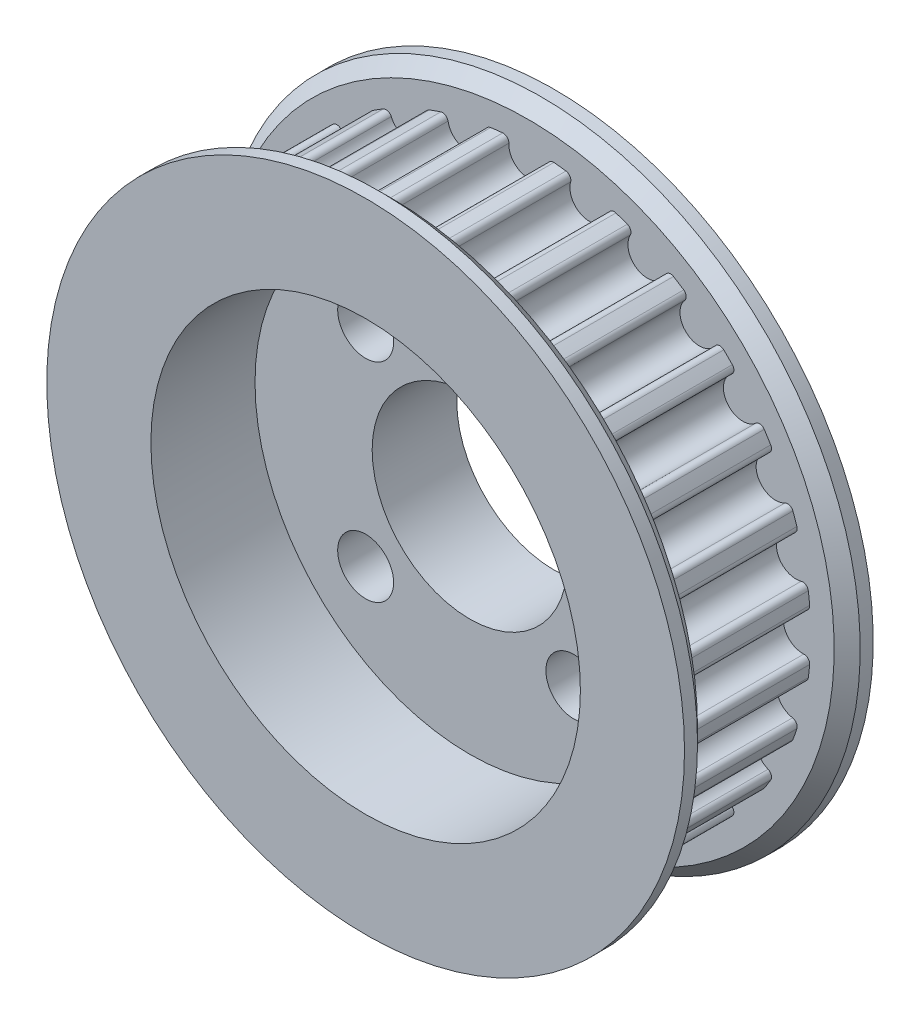
from build123d import *
from build123d.topology import SkipClean

# Parameters (mm, degrees)
CUT_EXTRUDE1_START     = 1.3716
CUT_EXTRUDE1_DEPTH     = 10.668
SKETCH5_R              = 2.0828
CUT_EXTRUDE2_DEPTH     = 36.371618123
CIRPATTERN1_COUNT      = 2
CIRPATTERN1_ANGLE      = 90
INTERSECT1_START       = 1.3716
INTERSECT1_OUTLINE_R   = 23.8125
INTERSECT1_OUTLINE_R_2 = 3.175
INTERSECT1_DEPTH       = 9.4488
INTERSECT2_START       = -10.8204
INTERSECT2_OUTLINE_R   = 23.8125
INTERSECT2_OUTLINE_R_2 = 3.175
INTERSECT2_DEPTH       = 1.691999918
SKETCH9_R              = 16.5
SKETCH9_R_2            = 4.1
CUT_EXTRUDE3_DEPTH     = 6
SKETCH11_R             = 7.5
CUT_EXTRUDE4_DEPTH     = 7
BOSS_EXTRUDE2_REACH    = 38.834
SKETCH12_R             = 16.5
SKETCH12_R_2           = 7.5
SKETCH12_3_R           = 24.5
SKETCH12_3_R_2         = 7.5
BOSS_EXTRUDE3_DEPTH    = 1
M4_CLEARANCE_HOLE1_D   = 4.3
BOSS_EXTRUDE4_START    = 1
SKETCH16_R             = 24.5
SKETCH16_R_2           = 16.5
BOSS_EXTRUDE4_DEPTH    = 1


# Read off the part's stored shape, not the designer's step: Intersect1, Intersect2
with BuildPart() as part:
    # Sketch3 → Revolve1 (revolve)
    with BuildSketch(Plane(origin=(0, 0, 0), x_dir=(0, 0, -1), z_dir=(1, 0, 0)), mode=Mode.PRIVATE) as revolve1_sk:
        Polygon((10.8204, 3.651), (10.8204, 17.1069), (10.3124, 17.1069), (10.3124, 22.225), (10.8204, 23.8125), (9.8044, 23.8125), (9.2964, 22.225), (9.2964, 21.7043), (-1.3716, 21.7043), (-1.3716, 22.225), (-1.8796, 23.8125), (-2.8956, 23.8125), (-2.3876, 22.225), (-2.3876, 17.1069), (-2.8956, 17.1069), (-2.8956, 15.0749), (-10.8204, 15.0749), (-10.8204, 3.651), (-10.3444, 3.175), (10.3444, 3.175), align=None)
    revolve(revolve1_sk.sketch.rotate(Axis((0, 0, 10.8204), (0, 0, -1)), 180), axis=Axis((0, 0, 10.8204), (0, 0, -1)))

    # Sketch4 → Cut-Extrude1 (cut)
    with SkipClean():  # the faces are left unmerged after this step: merging them gives an invalid solid
        with BuildSketch(Plane.XY.offset(CUT_EXTRUDE1_START)):
            with BuildLine():
                Line((-2.188041211, 21.593728584), (-2.412864046, 23.8125))
                Line((-2.412864046, 23.8125), (2.412864046, 23.8125))
                Line((2.412864046, 23.8125), (2.188041211, 21.593728584))
                ThreePointArc((2.188041211, 21.593728584), (2.077661488, 21.604628236), (1.967227505, 21.614963669))
                ThreePointArc((1.967227505, 21.614963669), (1.629214917, 21.49658956), (1.496806829, 21.16382382))
                ThreePointArc((1.496806829, 21.16382382), (0, 19.591934831), (-1.496806829, 21.16382382))
                ThreePointArc((-1.496806829, 21.16382382), (-1.629214917, 21.49658956), (-1.967227505, 21.614963669))
                ThreePointArc((-1.967227505, 21.614963669), (-2.077661488, 21.604628236), (-2.188041211, 21.593728584))
            make_face()
            with BuildLine():
                Line((2.671874203, 21.539213698), (2.946411233, 23.75238367))
                Line((2.946411233, 23.75238367), (7.651148247, 22.678558148))
                Line((7.651148247, 22.678558148), (6.938239101, 20.565443751))
                ThreePointArc((6.938239101, 20.565443751), (6.833052229, 20.600631925), (6.727686908, 20.6352821))
                ThreePointArc((6.727686908, 20.6352821), (6.371808284, 20.595090754), (6.1686726, 20.300131717))
                ThreePointArc((6.1686726, 20.300131717), (4.359615637, 19.100724121), (3.250115086, 20.966273425))
                ThreePointArc((3.250115086, 20.966273425), (3.195074088, 21.320159604), (2.891876899, 21.510780704))
                ThreePointArc((2.891876899, 21.510780704), (2.781911877, 21.525278275), (2.671874203, 21.539213698))
            make_face()
            with BuildLine():
                Line((7.397810687, 20.404632698), (8.15794115, 22.501223641))
                Line((8.15794115, 22.501223641), (12.505771926, 20.407418693))
                Line((12.505771926, 20.407418693), (11.340524712, 18.505921694))
                ThreePointArc((11.340524712, 18.505921694), (11.2458052, 18.563633909), (11.150791996, 18.620861321))
                ThreePointArc((11.150791996, 18.620861321), (10.794892576, 18.6608681), (10.531215368, 18.418506244))
                ThreePointArc((10.531215368, 18.418506244), (8.500621941, 17.651723345), (7.834062659, 19.717386532))
                ThreePointArc((7.834062659, 19.717386532), (7.859148737, 20.07464782), (7.605970519, 20.327957373))
                ThreePointArc((7.605970519, 20.327957373), (7.501988563, 20.366560978), (7.397810687, 20.404632698))
            make_face()
            with BuildLine():
                Line((11.752790053, 18.246878212), (12.960397832, 20.121758302))
                Line((12.960397832, 20.121758302), (16.733303981, 17.11296605))
                Line((16.733303981, 17.11296605), (15.174149059, 15.51843545))
                ThreePointArc((15.174149059, 15.51843545), (15.094646539, 15.595777773), (15.014749812, 15.672712802))
                ThreePointArc((15.014749812, 15.672712802), (14.67667588, 15.790911598), (14.365679023, 15.613299959))
                ThreePointArc((14.365679023, 15.613299959), (12.215371566, 15.317591454), (12.025177618, 17.479787546))
                ThreePointArc((12.025177618, 17.479787546), (12.129132852, 17.82250937), (11.938669019, 18.125805377))
                ThreePointArc((11.938669019, 18.125805377), (11.845884217, 18.186579272), (11.752790053, 18.246878212))
            make_face()
            with BuildLine():
                Line((15.51843545, 15.174149059), (17.11296605, 16.733303981))
                Line((17.11296605, 16.733303981), (20.121758302, 12.960397832))
                Line((20.121758302, 12.960397832), (18.246878212, 11.752790053))
                ThreePointArc((18.246878212, 11.752790053), (18.186579272, 11.845884217), (18.125805377, 11.938669019))
                ThreePointArc((18.125805377, 11.938669019), (17.82250937, 12.129132852), (17.479787546, 12.025177618))
                ThreePointArc((17.479787546, 12.025177618), (15.317591454, 12.215371566), (15.613299959, 14.365679023))
                ThreePointArc((15.613299959, 14.365679023), (15.790911598, 14.67667588), (15.672712802, 15.014749812))
                ThreePointArc((15.672712802, 15.014749812), (15.595777773, 15.094646539), (15.51843545, 15.174149059))
            make_face()
            with BuildLine():
                Line((18.505921694, 11.340524712), (20.407418693, 12.505771926))
                Line((20.407418693, 12.505771926), (22.501223641, 8.15794115))
                Line((22.501223641, 8.15794115), (20.404632698, 7.397810687))
                ThreePointArc((20.404632698, 7.397810687), (20.366560978, 7.501988563), (20.327957373, 7.605970519))
                ThreePointArc((20.327957373, 7.605970519), (20.07464782, 7.859148737), (19.717386532, 7.834062659))
                ThreePointArc((19.717386532, 7.834062659), (17.651723345, 8.500621941), (18.418506244, 10.531215368))
                ThreePointArc((18.418506244, 10.531215368), (18.6608681, 10.794892576), (18.620861321, 11.150791996))
                ThreePointArc((18.620861321, 11.150791996), (18.563633909, 11.2458052), (18.505921694, 11.340524712))
            make_face()
            with BuildLine():
                Line((20.565443751, 6.938239101), (22.678558148, 7.651148247))
                Line((22.678558148, 7.651148247), (23.75238367, 2.946411233))
                Line((23.75238367, 2.946411233), (21.539213698, 2.671874203))
                ThreePointArc((21.539213698, 2.671874203), (21.525278275, 2.781911877), (21.510780704, 2.891876899))
                ThreePointArc((21.510780704, 2.891876899), (21.320159604, 3.195074088), (20.966273425, 3.250115086))
                ThreePointArc((20.966273425, 3.250115086), (19.100724121, 4.359615637), (20.300131717, 6.1686726))
                ThreePointArc((20.300131717, 6.1686726), (20.595090754, 6.371808284), (20.6352821, 6.727686908))
                ThreePointArc((20.6352821, 6.727686908), (20.600631925, 6.833052229), (20.565443751, 6.938239101))
            make_face()
            with BuildLine():
                Line((21.593728584, 2.188041211), (23.8125, 2.412864046))
                Line((23.8125, 2.412864046), (23.8125, -2.412864046))
                Line((23.8125, -2.412864046), (21.593728584, -2.188041211))
                ThreePointArc((21.593728584, -2.188041211), (21.604628236, -2.077661488), (21.614963669, -1.967227505))
                ThreePointArc((21.614963669, -1.967227505), (21.49658956, -1.629214917), (21.16382382, -1.496806829))
                ThreePointArc((21.16382382, -1.496806829), (19.591934831, 0), (21.16382382, 1.496806829))
                ThreePointArc((21.16382382, 1.496806829), (21.49658956, 1.629214917), (21.614963669, 1.967227505))
                ThreePointArc((21.614963669, 1.967227505), (21.604628236, 2.077661488), (21.593728584, 2.188041211))
            make_face()
            with BuildLine():
                Line((21.539213698, -2.671874203), (23.75238367, -2.946411233))
                Line((23.75238367, -2.946411233), (22.678558148, -7.651148247))
                Line((22.678558148, -7.651148247), (20.565443751, -6.938239101))
                ThreePointArc((20.565443751, -6.938239101), (20.600631925, -6.833052229), (20.6352821, -6.727686908))
                ThreePointArc((20.6352821, -6.727686908), (20.595090754, -6.371808284), (20.300131717, -6.1686726))
                ThreePointArc((20.300131717, -6.1686726), (19.100724121, -4.359615637), (20.966273425, -3.250115086))
                ThreePointArc((20.966273425, -3.250115086), (21.320159604, -3.195074088), (21.510780704, -2.891876899))
                ThreePointArc((21.510780704, -2.891876899), (21.525278275, -2.781911877), (21.539213698, -2.671874203))
            make_face()
            with BuildLine():
                Line((20.404632698, -7.397810687), (22.501223641, -8.15794115))
                Line((22.501223641, -8.15794115), (20.407418693, -12.505771926))
                Line((20.407418693, -12.505771926), (18.505921694, -11.340524712))
                ThreePointArc((18.505921694, -11.340524712), (18.563633909, -11.2458052), (18.620861321, -11.150791996))
                ThreePointArc((18.620861321, -11.150791996), (18.6608681, -10.794892576), (18.418506244, -10.531215368))
                ThreePointArc((18.418506244, -10.531215368), (17.651723345, -8.500621941), (19.717386532, -7.834062659))
                ThreePointArc((19.717386532, -7.834062659), (20.07464782, -7.859148737), (20.327957373, -7.605970519))
                ThreePointArc((20.327957373, -7.605970519), (20.366560978, -7.501988563), (20.404632698, -7.397810687))
            make_face()
            with BuildLine():
                Line((18.246878212, -11.752790053), (20.121758302, -12.960397832))
                Line((20.121758302, -12.960397832), (17.11296605, -16.733303981))
                Line((17.11296605, -16.733303981), (15.51843545, -15.174149059))
                ThreePointArc((15.51843545, -15.174149059), (15.595777773, -15.094646539), (15.672712802, -15.014749812))
                ThreePointArc((15.672712802, -15.014749812), (15.790911598, -14.67667588), (15.613299959, -14.365679023))
                ThreePointArc((15.613299959, -14.365679023), (15.317591454, -12.215371566), (17.479787546, -12.025177618))
                ThreePointArc((17.479787546, -12.025177618), (17.82250937, -12.129132852), (18.125805377, -11.938669019))
                ThreePointArc((18.125805377, -11.938669019), (18.186579272, -11.845884217), (18.246878212, -11.752790053))
            make_face()
            with BuildLine():
                Line((15.174149059, -15.51843545), (16.733303981, -17.11296605))
                Line((16.733303981, -17.11296605), (12.960397832, -20.121758302))
                Line((12.960397832, -20.121758302), (11.752790053, -18.246878212))
                ThreePointArc((11.752790053, -18.246878212), (11.845884217, -18.186579272), (11.938669019, -18.125805377))
                ThreePointArc((11.938669019, -18.125805377), (12.129132852, -17.82250937), (12.025177618, -17.479787546))
                ThreePointArc((12.025177618, -17.479787546), (12.215371566, -15.317591454), (14.365679023, -15.613299959))
                ThreePointArc((14.365679023, -15.613299959), (14.67667588, -15.790911598), (15.014749812, -15.672712802))
                ThreePointArc((15.014749812, -15.672712802), (15.094646539, -15.595777773), (15.174149059, -15.51843545))
            make_face()
            with BuildLine():
                Line((11.340524712, -18.505921694), (12.505771926, -20.407418693))
                Line((12.505771926, -20.407418693), (8.15794115, -22.501223641))
                Line((8.15794115, -22.501223641), (7.397810687, -20.404632698))
                ThreePointArc((7.397810687, -20.404632698), (7.501988563, -20.366560978), (7.605970519, -20.327957373))
                ThreePointArc((7.605970519, -20.327957373), (7.859148737, -20.07464782), (7.834062659, -19.717386532))
                ThreePointArc((7.834062659, -19.717386532), (8.500621941, -17.651723345), (10.531215368, -18.418506244))
                ThreePointArc((10.531215368, -18.418506244), (10.794892576, -18.6608681), (11.150791996, -18.620861321))
                ThreePointArc((11.150791996, -18.620861321), (11.2458052, -18.563633909), (11.340524712, -18.505921694))
            make_face()
            with BuildLine():
                Line((6.938239101, -20.565443751), (7.651148247, -22.678558148))
                Line((7.651148247, -22.678558148), (2.946411233, -23.75238367))
                Line((2.946411233, -23.75238367), (2.671874203, -21.539213698))
                ThreePointArc((2.671874203, -21.539213698), (2.781911877, -21.525278275), (2.891876899, -21.510780704))
                ThreePointArc((2.891876899, -21.510780704), (3.195074088, -21.320159604), (3.250115086, -20.966273425))
                ThreePointArc((3.250115086, -20.966273425), (4.359615637, -19.100724121), (6.1686726, -20.300131717))
                ThreePointArc((6.1686726, -20.300131717), (6.371808284, -20.595090754), (6.727686908, -20.6352821))
                ThreePointArc((6.727686908, -20.6352821), (6.833052229, -20.600631925), (6.938239101, -20.565443751))
            make_face()
            with BuildLine():
                Line((2.188041211, -21.593728584), (2.412864046, -23.8125))
                Line((2.412864046, -23.8125), (-2.412864046, -23.8125))
                Line((-2.412864046, -23.8125), (-2.188041211, -21.593728584))
                ThreePointArc((-2.188041211, -21.593728584), (-2.077661488, -21.604628236), (-1.967227505, -21.614963669))
                ThreePointArc((-1.967227505, -21.614963669), (-1.629214917, -21.49658956), (-1.496806829, -21.16382382))
                ThreePointArc((-1.496806829, -21.16382382), (0, -19.591934831), (1.496806829, -21.16382382))
                ThreePointArc((1.496806829, -21.16382382), (1.629214917, -21.49658956), (1.967227505, -21.614963669))
                ThreePointArc((1.967227505, -21.614963669), (2.077661488, -21.604628236), (2.188041211, -21.593728584))
            make_face()
            with BuildLine():
                Line((-2.671874203, -21.539213698), (-2.946411233, -23.75238367))
                Line((-2.946411233, -23.75238367), (-7.651148247, -22.678558148))
                Line((-7.651148247, -22.678558148), (-6.938239101, -20.565443751))
                ThreePointArc((-6.938239101, -20.565443751), (-6.833052229, -20.600631925), (-6.727686908, -20.6352821))
                ThreePointArc((-6.727686908, -20.6352821), (-6.371808284, -20.595090754), (-6.1686726, -20.300131717))
                ThreePointArc((-6.1686726, -20.300131717), (-4.359615637, -19.100724121), (-3.250115086, -20.966273425))
                ThreePointArc((-3.250115086, -20.966273425), (-3.195074088, -21.320159604), (-2.891876899, -21.510780704))
                ThreePointArc((-2.891876899, -21.510780704), (-2.781911877, -21.525278275), (-2.671874203, -21.539213698))
            make_face()
            with BuildLine():
                Line((-7.397810687, -20.404632698), (-8.15794115, -22.501223641))
                Line((-8.15794115, -22.501223641), (-12.505771926, -20.407418693))
                Line((-12.505771926, -20.407418693), (-11.340524712, -18.505921694))
                ThreePointArc((-11.340524712, -18.505921694), (-11.2458052, -18.563633909), (-11.150791996, -18.620861321))
                ThreePointArc((-11.150791996, -18.620861321), (-10.794892576, -18.6608681), (-10.531215368, -18.418506244))
                ThreePointArc((-10.531215368, -18.418506244), (-8.500621941, -17.651723345), (-7.834062659, -19.717386532))
                ThreePointArc((-7.834062659, -19.717386532), (-7.859148737, -20.07464782), (-7.605970519, -20.327957373))
                ThreePointArc((-7.605970519, -20.327957373), (-7.501988563, -20.366560978), (-7.397810687, -20.404632698))
            make_face()
            with BuildLine():
                Line((-11.752790053, -18.246878212), (-12.960397832, -20.121758302))
                Line((-12.960397832, -20.121758302), (-16.733303981, -17.11296605))
                Line((-16.733303981, -17.11296605), (-15.174149059, -15.51843545))
                ThreePointArc((-15.174149059, -15.51843545), (-15.094646539, -15.595777773), (-15.014749812, -15.672712802))
                ThreePointArc((-15.014749812, -15.672712802), (-14.67667588, -15.790911598), (-14.365679023, -15.613299959))
                ThreePointArc((-14.365679023, -15.613299959), (-12.215371566, -15.317591454), (-12.025177618, -17.479787546))
                ThreePointArc((-12.025177618, -17.479787546), (-12.129132852, -17.82250937), (-11.938669019, -18.125805377))
                ThreePointArc((-11.938669019, -18.125805377), (-11.845884217, -18.186579272), (-11.752790053, -18.246878212))
            make_face()
            with BuildLine():
                Line((-15.51843545, -15.174149059), (-17.11296605, -16.733303981))
                Line((-17.11296605, -16.733303981), (-20.121758302, -12.960397832))
                Line((-20.121758302, -12.960397832), (-18.246878212, -11.752790053))
                ThreePointArc((-18.246878212, -11.752790053), (-18.186579272, -11.845884217), (-18.125805377, -11.938669019))
                ThreePointArc((-18.125805377, -11.938669019), (-17.82250937, -12.129132852), (-17.479787546, -12.025177618))
                ThreePointArc((-17.479787546, -12.025177618), (-15.317591454, -12.215371566), (-15.613299959, -14.365679023))
                ThreePointArc((-15.613299959, -14.365679023), (-15.790911598, -14.67667588), (-15.672712802, -15.014749812))
                ThreePointArc((-15.672712802, -15.014749812), (-15.595777773, -15.094646539), (-15.51843545, -15.174149059))
            make_face()
            with BuildLine():
                Line((-18.505921694, -11.340524712), (-20.407418693, -12.505771926))
                Line((-20.407418693, -12.505771926), (-22.501223641, -8.15794115))
                Line((-22.501223641, -8.15794115), (-20.404632698, -7.397810687))
                ThreePointArc((-20.404632698, -7.397810687), (-20.366560978, -7.501988563), (-20.327957373, -7.605970519))
                ThreePointArc((-20.327957373, -7.605970519), (-20.07464782, -7.859148737), (-19.717386532, -7.834062659))
                ThreePointArc((-19.717386532, -7.834062659), (-17.651723345, -8.500621941), (-18.418506244, -10.531215368))
                ThreePointArc((-18.418506244, -10.531215368), (-18.6608681, -10.794892576), (-18.620861321, -11.150791996))
                ThreePointArc((-18.620861321, -11.150791996), (-18.563633909, -11.2458052), (-18.505921694, -11.340524712))
            make_face()
            with BuildLine():
                Line((-20.565443751, -6.938239101), (-22.678558148, -7.651148247))
                Line((-22.678558148, -7.651148247), (-23.75238367, -2.946411233))
                Line((-23.75238367, -2.946411233), (-21.539213698, -2.671874203))
                ThreePointArc((-21.539213698, -2.671874203), (-21.525278275, -2.781911877), (-21.510780704, -2.891876899))
                ThreePointArc((-21.510780704, -2.891876899), (-21.320159604, -3.195074088), (-20.966273425, -3.250115086))
                ThreePointArc((-20.966273425, -3.250115086), (-19.100724121, -4.359615637), (-20.300131717, -6.1686726))
                ThreePointArc((-20.300131717, -6.1686726), (-20.595090754, -6.371808284), (-20.6352821, -6.727686908))
                ThreePointArc((-20.6352821, -6.727686908), (-20.600631925, -6.833052229), (-20.565443751, -6.938239101))
            make_face()
            with BuildLine():
                Line((-21.593728584, -2.188041211), (-23.8125, -2.412864046))
                Line((-23.8125, -2.412864046), (-23.8125, 2.412864046))
                Line((-23.8125, 2.412864046), (-21.593728584, 2.188041211))
                ThreePointArc((-21.593728584, 2.188041211), (-21.604628236, 2.077661488), (-21.614963669, 1.967227505))
                ThreePointArc((-21.614963669, 1.967227505), (-21.49658956, 1.629214917), (-21.16382382, 1.496806829))
                ThreePointArc((-21.16382382, 1.496806829), (-19.591934831, 0), (-21.16382382, -1.496806829))
                ThreePointArc((-21.16382382, -1.496806829), (-21.49658956, -1.629214917), (-21.614963669, -1.967227505))
                ThreePointArc((-21.614963669, -1.967227505), (-21.604628236, -2.077661488), (-21.593728584, -2.188041211))
            make_face()
            with BuildLine():
                Line((-21.539213698, 2.671874203), (-23.75238367, 2.946411233))
                Line((-23.75238367, 2.946411233), (-22.678558148, 7.651148247))
                Line((-22.678558148, 7.651148247), (-20.565443751, 6.938239101))
                ThreePointArc((-20.565443751, 6.938239101), (-20.600631925, 6.833052229), (-20.6352821, 6.727686908))
                ThreePointArc((-20.6352821, 6.727686908), (-20.595090754, 6.371808284), (-20.300131717, 6.1686726))
                ThreePointArc((-20.300131717, 6.1686726), (-19.100724121, 4.359615637), (-20.966273425, 3.250115086))
                ThreePointArc((-20.966273425, 3.250115086), (-21.320159604, 3.195074088), (-21.510780704, 2.891876899))
                ThreePointArc((-21.510780704, 2.891876899), (-21.525278275, 2.781911877), (-21.539213698, 2.671874203))
            make_face()
            with BuildLine():
                Line((-20.404632698, 7.397810687), (-22.501223641, 8.15794115))
                Line((-22.501223641, 8.15794115), (-20.407418693, 12.505771926))
                Line((-20.407418693, 12.505771926), (-18.505921694, 11.340524712))
                ThreePointArc((-18.505921694, 11.340524712), (-18.563633909, 11.2458052), (-18.620861321, 11.150791996))
                ThreePointArc((-18.620861321, 11.150791996), (-18.6608681, 10.794892576), (-18.418506244, 10.531215368))
                ThreePointArc((-18.418506244, 10.531215368), (-17.651723345, 8.500621941), (-19.717386532, 7.834062659))
                ThreePointArc((-19.717386532, 7.834062659), (-20.07464782, 7.859148737), (-20.327957373, 7.605970519))
                ThreePointArc((-20.327957373, 7.605970519), (-20.366560978, 7.501988563), (-20.404632698, 7.397810687))
            make_face()
            with BuildLine():
                Line((-18.246878212, 11.752790053), (-20.121758302, 12.960397832))
                Line((-20.121758302, 12.960397832), (-17.11296605, 16.733303981))
                Line((-17.11296605, 16.733303981), (-15.51843545, 15.174149059))
                ThreePointArc((-15.51843545, 15.174149059), (-15.595777773, 15.094646539), (-15.672712802, 15.014749812))
                ThreePointArc((-15.672712802, 15.014749812), (-15.790911598, 14.67667588), (-15.613299959, 14.365679023))
                ThreePointArc((-15.613299959, 14.365679023), (-15.317591454, 12.215371566), (-17.479787546, 12.025177618))
                ThreePointArc((-17.479787546, 12.025177618), (-17.82250937, 12.129132852), (-18.125805377, 11.938669019))
                ThreePointArc((-18.125805377, 11.938669019), (-18.186579272, 11.845884217), (-18.246878212, 11.752790053))
            make_face()
            with BuildLine():
                Line((-15.174149059, 15.51843545), (-16.733303981, 17.11296605))
                Line((-16.733303981, 17.11296605), (-12.960397832, 20.121758302))
                Line((-12.960397832, 20.121758302), (-11.752790053, 18.246878212))
                ThreePointArc((-11.752790053, 18.246878212), (-11.845884217, 18.186579272), (-11.938669019, 18.125805377))
                ThreePointArc((-11.938669019, 18.125805377), (-12.129132852, 17.82250937), (-12.025177618, 17.479787546))
                ThreePointArc((-12.025177618, 17.479787546), (-12.215371566, 15.317591454), (-14.365679023, 15.613299959))
                ThreePointArc((-14.365679023, 15.613299959), (-14.67667588, 15.790911598), (-15.014749812, 15.672712802))
                ThreePointArc((-15.014749812, 15.672712802), (-15.094646539, 15.595777773), (-15.174149059, 15.51843545))
            make_face()
            with BuildLine():
                Line((-11.340524712, 18.505921694), (-12.505771926, 20.407418693))
                Line((-12.505771926, 20.407418693), (-8.15794115, 22.501223641))
                Line((-8.15794115, 22.501223641), (-7.397810687, 20.404632698))
                ThreePointArc((-7.397810687, 20.404632698), (-7.501988563, 20.366560978), (-7.605970519, 20.327957373))
                ThreePointArc((-7.605970519, 20.327957373), (-7.859148737, 20.07464782), (-7.834062659, 19.717386532))
                ThreePointArc((-7.834062659, 19.717386532), (-8.500621941, 17.651723345), (-10.531215368, 18.418506244))
                ThreePointArc((-10.531215368, 18.418506244), (-10.794892576, 18.6608681), (-11.150791996, 18.620861321))
                ThreePointArc((-11.150791996, 18.620861321), (-11.2458052, 18.563633909), (-11.340524712, 18.505921694))
            make_face()
            with BuildLine():
                Line((-6.938239101, 20.565443751), (-7.651148247, 22.678558148))
                Line((-7.651148247, 22.678558148), (-2.946411233, 23.75238367))
                Line((-2.946411233, 23.75238367), (-2.671874203, 21.539213698))
                ThreePointArc((-2.671874203, 21.539213698), (-2.781911877, 21.525278275), (-2.891876899, 21.510780704))
                ThreePointArc((-2.891876899, 21.510780704), (-3.195074088, 21.320159604), (-3.250115086, 20.966273425))
                ThreePointArc((-3.250115086, 20.966273425), (-4.359615637, 19.100724121), (-6.1686726, 20.300131717))
                ThreePointArc((-6.1686726, 20.300131717), (-6.371808284, 20.595090754), (-6.727686908, 20.6352821))
                ThreePointArc((-6.727686908, 20.6352821), (-6.833052229, 20.600631925), (-6.938239101, 20.565443751))
            make_face()
        extrude(amount=-CUT_EXTRUDE1_DEPTH, mode=Mode.SUBTRACT)

    # Sketch5 → Cut-Extrude2 (cut, through all)
    with SkipClean():  # the faces are left unmerged after this step: merging them gives an invalid solid
        with BuildSketch(Plane(origin=(0, 0, 0), x_dir=(1, 0, 0), z_dir=(0, 1, 0))):
            with Locations(Location((0, -7.6454, 0), (0, 0, 90))):
                Circle(SKETCH5_R)
        cut_extrude2 = extrude(amount=CUT_EXTRUDE2_DEPTH, mode=Mode.SUBTRACT)

    # CirPattern1: Cut-Extrude2 ×2 about axis
    with SkipClean():  # the faces are left unmerged after this step: merging them gives an invalid solid
        cirpattern1_axis = Axis((0, 0, 10.8204), (0, 0, -1))
        for i in range(1, CIRPATTERN1_COUNT):
            add(cut_extrude2.rotate(cirpattern1_axis, i * CIRPATTERN1_ANGLE / (CIRPATTERN1_COUNT - 1)), mode=Mode.SUBTRACT)

    # Intersect1 outline → Intersect1 (cut)
    with SkipClean():  # the faces are left unmerged after this step: merging them gives an invalid solid
        with BuildSketch(Plane.XY.offset(INTERSECT1_START)):
            Circle(INTERSECT1_OUTLINE_R)
            Circle(INTERSECT1_OUTLINE_R_2, mode=Mode.SUBTRACT)
        extrude(amount=INTERSECT1_DEPTH, mode=Mode.SUBTRACT)

    # Intersect2 outline → Intersect2 (cut)
    with SkipClean():  # the faces are left unmerged after this step: merging them gives an invalid solid
        with BuildSketch(Plane.XY.offset(INTERSECT2_START)):
            Circle(INTERSECT2_OUTLINE_R)
            Circle(INTERSECT2_OUTLINE_R_2, mode=Mode.SUBTRACT)
        extrude(amount=INTERSECT2_DEPTH, mode=Mode.SUBTRACT)

    # Sketch9 → Cut-Extrude3 (cut)
    # profile 1 of 2: a face of its own
    with SkipClean():  # the faces are left unmerged after this step: merging them gives an invalid solid
        with BuildSketch(Plane.XY.offset(1.3716)):
            Circle(SKETCH9_R)
            Circle(SKETCH9_R_2, mode=Mode.SUBTRACT)
        # profile 2 of 2: a face of its own
        with BuildSketch(Plane.XY.offset(1.3716)):
            Circle(SKETCH9_R_2)
        extrude(amount=-CUT_EXTRUDE3_DEPTH, mode=Mode.SUBTRACT)

    # Sketch10 → Revolve2 (revolve)
    with BuildSketch(Plane(origin=(0, 0, 0), x_dir=(1, 0, 0), z_dir=(0, 1, 0))):
        Polygon((-23.5, -1.3716), (-16.5, -1.3716), (-16.5, -2.3716), (-24.5, -2.3716), align=None)
        Polygon((-23.5, 9.128400082), (-16.5, 9.128400082), (-16.5, 10.128400082), (-24.5, 10.128400082), align=None)
    revolve(axis=Axis((0, 0, -4.6284), (0, 0, 1)))

    # Sketch11 → Cut-Extrude4 (cut)
    with BuildSketch(Plane.XY.offset(-4.6284)):
        Circle(SKETCH11_R)
    extrude(amount=-CUT_EXTRUDE4_DEPTH, mode=Mode.SUBTRACT)

    # Sketch12 → Boss-Extrude2 (add, up to next)
    with BuildSketch(Plane(origin=(0, 0, -10.128400082), x_dir=(-1, 0, 0), z_dir=(0, 0, -1)), mode=Mode.PRIVATE) as boss_extrude2_sk1:
        with Locations(Location((0, 0, 0), (0, 0, 180))):
            Circle(SKETCH12_R)
        with Locations(Location((0, 0, 0), (0, 0, 180))):
            Circle(SKETCH12_R_2, mode=Mode.SUBTRACT)
    boss_extrude2_tool1 = extrude(boss_extrude2_sk1.sketch, amount=-BOSS_EXTRUDE2_REACH, mode=Mode.PRIVATE) - part.part
    add(boss_extrude2_tool1.solids().sort_by_distance((-16.03331, 0, -10.1284))[0])

    # Sketch12<3> → Boss-Extrude3 (add)
    with BuildSketch(Plane(origin=(0, 0, -10.128400082), x_dir=(-1, 0, 0), z_dir=(0, 0, -1))):
        Circle(SKETCH12_3_R)
        with Locations(Location((0, 0, 0), (0, 0, 180))):
            Circle(SKETCH12_3_R_2, mode=Mode.SUBTRACT)
    extrude(amount=BOSS_EXTRUDE3_DEPTH)

    # M4 Clearance Hole1 (through all)
    with Locations(Plane(origin=(0, 0, -11.128400082), x_dir=(-1, 0, 0), z_dir=(0, 0, -1))):
        with Locations((8, 8), (0, 0), (8, -8), (-8, -8), (-8, 8)):
            Hole(M4_CLEARANCE_HOLE1_D / 2)

    # Sketch16 → Boss-Extrude4 (add)
    with BuildSketch(Plane.XY.offset(2.3716).offset(BOSS_EXTRUDE4_START)):
        with Locations(Location((0, 0, 0), (0, 0, 180))):
            Circle(SKETCH16_R)
        Circle(SKETCH16_R_2, mode=Mode.SUBTRACT)
    extrude(amount=-BOSS_EXTRUDE4_DEPTH)


solid = part.part
